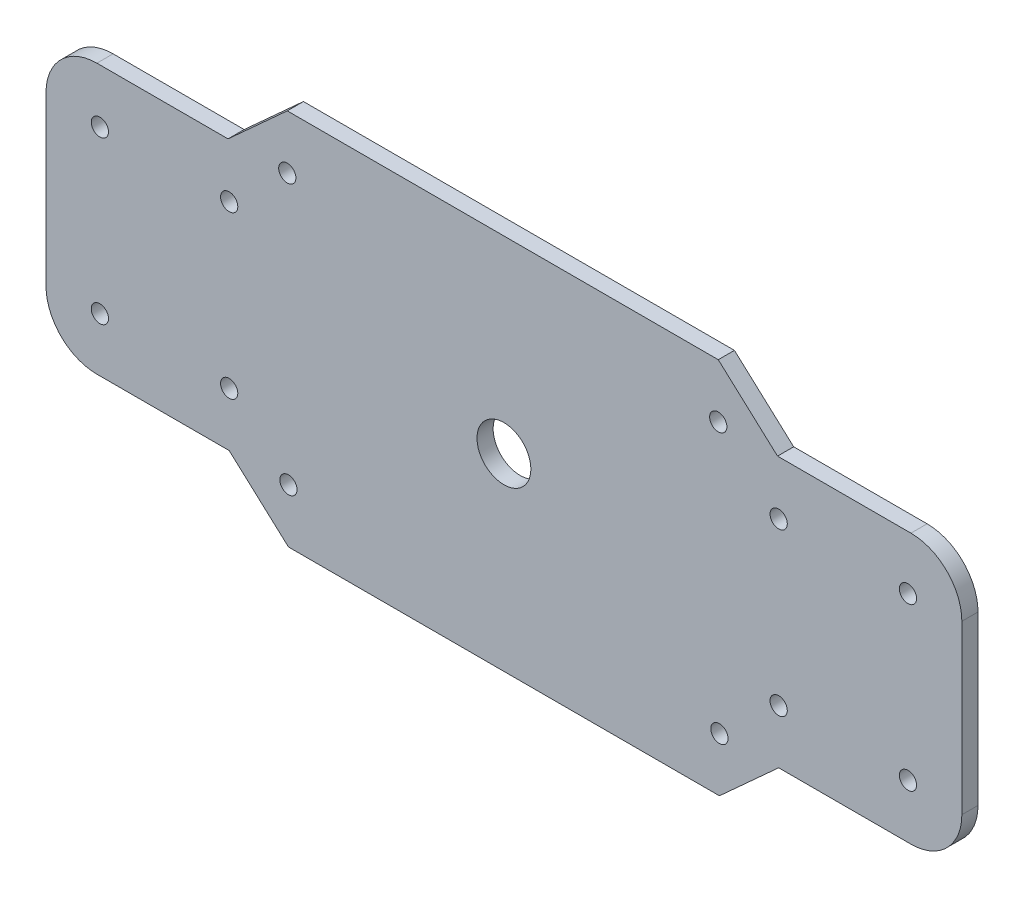
from build123d import *

# Parameters (mm, degrees)
SKETCH2_R           = 1.6
SKETCH2_R_2         = 5
BOSS_EXTRUDE4_DEPTH = 3


with BuildPart() as part:
    # Sketch2 → Boss-Extrude4 (new body)
    with BuildSketch(Plane.XY):
        with BuildLine():
            Line((-47.874505913, 29.703046769), (-36.874505913, 39.703046769))
            Line((-36.874505913, 39.703046769), (43.125494087, 39.703046769))
            Line((43.125494087, 39.703046769), (54.125494087, 29.703046769))
            Line((54.125494087, 29.703046769), (78.888347107, 29.703046769))
            ThreePointArc((78.888347107, 29.703046769), (85.570615229, 26.935160685), (88.338501313, 20.252892563))
            Line((88.338501313, 20.252892563), (88.338501313, -10.846799025))
            ThreePointArc((88.338501313, -10.846799025), (85.570615229, -17.529067148), (78.888347107, -20.296953231))
            Line((78.888347107, -20.296953231), (54.338501313, -20.296953231))
            Line((54.338501313, -20.296953231), (43.338501313, -30.296953231))
            Line((43.338501313, -30.296953231), (-36.661498687, -30.296953231))
            Line((-36.661498687, -30.296953231), (-47.661498687, -20.296953231))
            Line((-47.661498687, -20.296953231), (-72.211344481, -20.296953231))
            ThreePointArc((-72.211344481, -20.296953231), (-78.893612604, -17.529067148), (-81.661498687, -10.846799025))
            Line((-81.661498687, -10.846799025), (-81.661498687, 20.252892563))
            ThreePointArc((-81.661498687, 20.252892563), (-78.893612604, 26.935160685), (-72.211344481, 29.703046769))
            Line((-72.211344481, 29.703046769), (-47.874505913, 29.703046769))
        make_face()
        with Locations((-47.661498687, 19.703046769)):
            Circle(SKETCH2_R, mode=Mode.SUBTRACT)
        with Locations((-71.661498687, 19.703046769)):
            Circle(SKETCH2_R, mode=Mode.SUBTRACT)
        with Locations((-71.661498687, -10.296953231)):
            Circle(SKETCH2_R, mode=Mode.SUBTRACT)
        with Locations((-47.661498687, -10.296953231)):
            Circle(SKETCH2_R, mode=Mode.SUBTRACT)
        with Locations((78.338501313, -10.296953231)):
            Circle(SKETCH2_R, mode=Mode.SUBTRACT)
        with Locations((54.338501313, -10.296953231)):
            Circle(SKETCH2_R, mode=Mode.SUBTRACT)
        with Locations((78.338501313, 19.703046769)):
            Circle(SKETCH2_R, mode=Mode.SUBTRACT)
        with Locations((54.338501313, 19.703046769)):
            Circle(SKETCH2_R, mode=Mode.SUBTRACT)
        with Locations((3.338501313, 4.703046769)):
            Circle(SKETCH2_R_2, mode=Mode.SUBTRACT)
        with Locations((-36.874505913, 29.703046769)):
            Circle(SKETCH2_R, mode=Mode.SUBTRACT)
        with Locations((-36.661498687, -20.296953231)):
            Circle(SKETCH2_R, mode=Mode.SUBTRACT)
        with Locations((43.338501313, -20.296953231)):
            Circle(SKETCH2_R, mode=Mode.SUBTRACT)
        with Locations((43.125494087, 29.703046769)):
            Circle(SKETCH2_R, mode=Mode.SUBTRACT)
    extrude(amount=BOSS_EXTRUDE4_DEPTH)


solid = part.part
